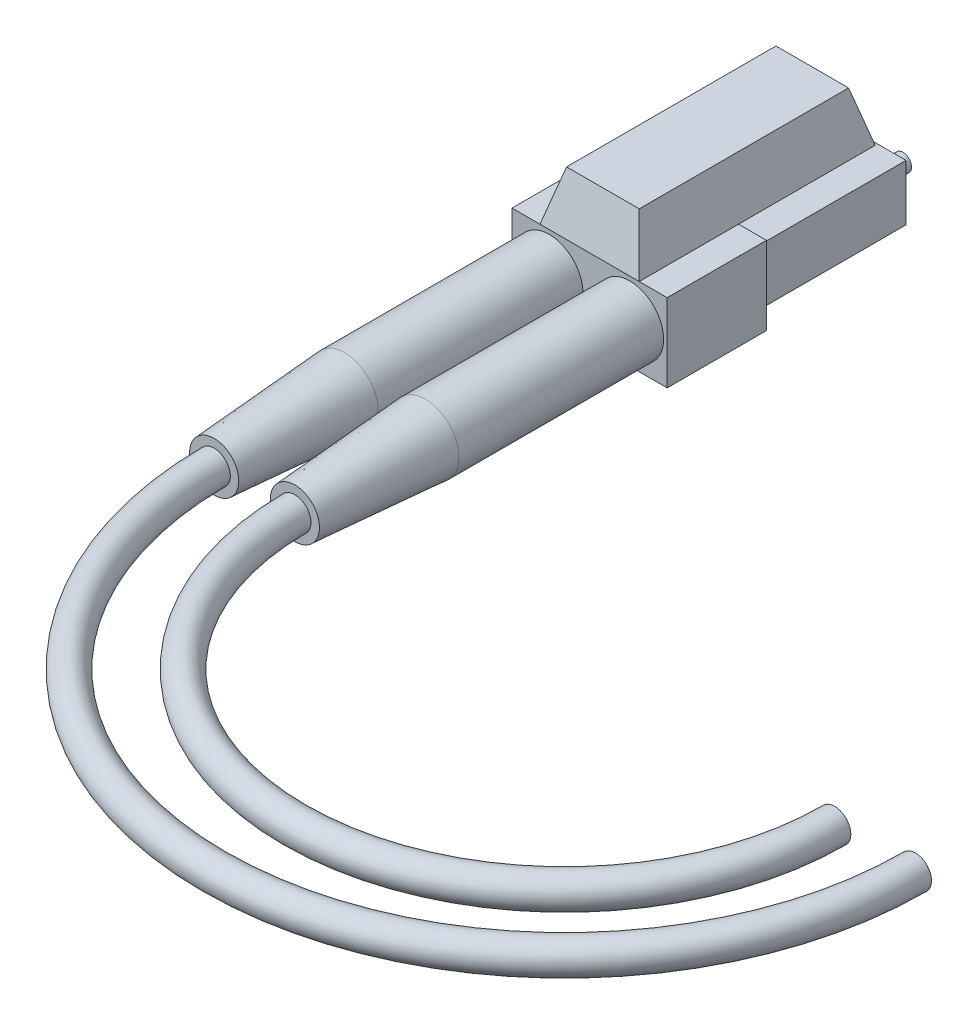
from build123d import *

# Parameters (mm, degrees)
SKETCH1_W                     = 4.5
SKETCH1_H                     = 4.5
BOSS_EXTRUDE1_DEPTH           = 12
BOSS_EXTRUDE1_2_DEPTH         = 12
SKETCH2_R                     = 0.691748062
BOSS_EXTRUDE2_DEPTH           = 2
SKETCH3_W                     = 12.5
SKETCH3_H                     = 6.3
BOSS_EXTRUDE3_DEPTH           = 8
SKETCH4_R                     = 2.715
BOSS_EXTRUDE4_DEPTH           = 16.5
SKETCH5_R                     = 2.715
BOSS_EXTRUDE5_DEPTH           = 10.5
BOSS_EXTRUDE5_DRAFT           = 4
BOSS_EXTRUDE5_PROFILE_2_DEPTH = 10.5
BOSS_EXTRUDE5_PROFILE_2_DRAFT = 4
SKETCH8_W                     = 8
SKETCH8_H                     = 19.014368052
BOSS_EXTRUDE8_DEPTH           = 4
BOSS_EXTRUDE8_TAPER           = 15
PROFILE1_R                    = 1.3


with BuildPart() as part:
    # Sketch1 → Boss-Extrude1 (new body)
    with BuildSketch(Plane.XY):
        with Locations((3.245938438, 2.25)):
            Rectangle(SKETCH1_W, SKETCH1_H)
    extrude(amount=-BOSS_EXTRUDE1_DEPTH)



with BuildPart() as body_2:
    # Sketch1 → Boss-Extrude1 2 (new body)
    with BuildSketch(Plane.XY):
        with Locations((-3.254061562, 2.25)):
            Rectangle(SKETCH1_W, SKETCH1_H)
    extrude(amount=-BOSS_EXTRUDE1_2_DEPTH)


with BuildPart() as part_1:
    add(part.part)

    add(body_2.part)  # Boss-Extrude2 merges body 2
    # Sketch2 → Boss-Extrude2 (add)
    with BuildSketch(Plane(origin=(0, 0, -12), x_dir=(-1, 0, 0), z_dir=(0, 0, -1))):
        with Locations((3.25, 2.25)):
            Circle(SKETCH2_R)
        with Locations((-3.25, 2.25)):
            Circle(SKETCH2_R)
    extrude(amount=BOSS_EXTRUDE2_DEPTH)

    # Sketch3 → Boss-Extrude3 (add)
    with BuildSketch(Plane.XY):
        with Locations((0, 2.15)):
            Rectangle(SKETCH3_W, SKETCH3_H)
    extrude(amount=BOSS_EXTRUDE3_DEPTH)

    # Sketch4 → Boss-Extrude4 (add)
    with BuildSketch(Plane.XY.offset(8)):
        with Locations((3.25, 2.25)):
            Circle(SKETCH4_R)
        with Locations((-3.25, 2.25)):
            Circle(SKETCH4_R)
    extrude(amount=BOSS_EXTRUDE4_DEPTH)


with BuildPart() as boss_extrude5_tool:
    # Sketch5 → Boss-Extrude5 (with draft: the straight prism first)
    with BuildSketch(Plane.XY.offset(24.5)):
        with Locations((-3.25, 2.25)):
            Circle(SKETCH5_R)
    extrude(amount=BOSS_EXTRUDE5_DEPTH)
    # Boss-Extrude5: the draft: its side faces are tilted about the plane it starts from
    boss_extrude5_sides = [boss_extrude5_tool.faces().sort_by_distance(p)[0] for p in [
        (-5.965, 2.25, 29.75),
    ]]
    draft(boss_extrude5_sides, Plane.XY.offset(24.5), BOSS_EXTRUDE5_DRAFT)


with BuildPart() as part_2:
    add(part_1.part)

    # Boss-Extrude5: add boss_extrude5_tool
    add(boss_extrude5_tool.part)


with BuildPart() as boss_extrude5_profile_2_tool:
    # Sketch5 → Boss-Extrude5 profile 2 (with draft: the straight prism first)
    with BuildSketch(Plane.XY.offset(24.5)):
        with Locations((3.25, 2.25)):
            Circle(SKETCH5_R)
    extrude(amount=BOSS_EXTRUDE5_PROFILE_2_DEPTH)
    # Boss-Extrude5 profile 2: the draft: its side faces are tilted about the plane it starts from
    boss_extrude5_profile_2_sides = [boss_extrude5_profile_2_tool.faces().sort_by_distance(p)[0] for p in [
        (0.535, 2.25, 29.75),
    ]]
    draft(boss_extrude5_profile_2_sides, Plane.XY.offset(24.5), BOSS_EXTRUDE5_PROFILE_2_DRAFT)


with BuildPart() as part_3:
    add(part_2.part)

    # Boss-Extrude5 profile 2: add boss_extrude5_profile_2_tool
    add(boss_extrude5_profile_2_tool.part)

    # Sketch8 → Boss-Extrude8 (add)
    with BuildSketch(Plane(origin=(0, 5.3, 0), x_dir=(1, 0, 0), z_dir=(0, 1, 0))):
        with Locations((0, 1.507184026)):
            Rectangle(SKETCH8_W, SKETCH8_H)
    extrude(amount=BOSS_EXTRUDE8_DEPTH, taper=BOSS_EXTRUDE8_TAPER)

    # Sweep1: sweep along a path in path1
    with BuildLine(Plane.XZ.offset(-2.25)) as sweep1_path:
        ThreePointArc((0, 35), (25, 60), (50, 35))
    # profile1 → Sweep1 (sweep)
    with BuildSketch(Plane.XY.offset(35)):
        with Locations((-3.25, 2.25)):
            Circle(PROFILE1_R)
        with Locations((3.25, 2.25)):
            Circle(PROFILE1_R)
    sweep(path=sweep1_path.line)


solid = part_3.part
